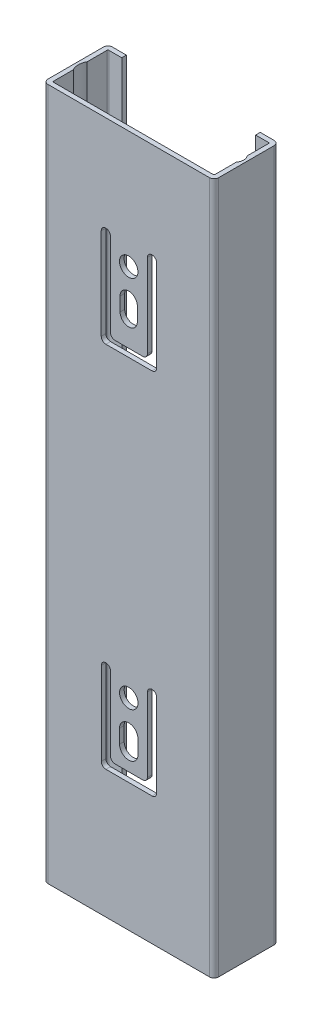
from build123d import *

# Parameters (mm, degrees)
BOSS_EXTRUDE1_DEPTH = 150
FILLET1_R           = 1
FILLET2_R           = 0.2
SKETCH2_R           = 2
CUT_EXTRUDE1_DEPTH  = 155.280557534
CUT_EXTRUDE2_DEPTH  = 155.280557534
CUT_EXTRUDE3_DEPTH  = 150
FILLET7_R           = 1
SKETCH7_R           = 2
CUT_EXTRUDE4_DEPTH  = 155.280557534
CUT_EXTRUDE6_DEPTH  = 155.280557534
FILLET9_R           = 1
SKETCH12_R          = 2
SKETCH12_R_2        = 3
CUT_EXTRUDE7_DEPTH  = 155.520226026


with BuildPart() as part:
    # Sketch1 → Boss-Extrude1 (new body)
    with BuildSketch(Plane(origin=(0, 0, 0), x_dir=(1, 0, 0), z_dir=(0, 1, 0))):
        Polygon((-2.736049046, -15.431975477), (32.263950954, -15.431975477), (32.263950954, -3.431975477), (29.263950954, -3.431975477), (29.263950954, -2.431975477), (33.263950954, -2.431975477), (33.263950954, -16.431975477), (-3.736049046, -16.431975477), (-3.736049046, -2.431975477), (0.263950954, -2.431975477), (0.263950954, -3.431975477), (-2.736049046, -3.431975477), align=None)
    extrude(amount=BOSS_EXTRUDE1_DEPTH)

    # Fillet1
    fillet1_edges = [part.edges().sort_by_distance(p)[0] for p in [
        (33.263950954, 75, 2.431975477),
        (33.263950954, 75, 16.431975477),
        (-3.736049046, 75, 16.431975477),
        (-3.736049046, 75, 2.431975477),
    ]]
    fillet(fillet1_edges, radius=FILLET1_R)

    # Fillet2
    fillet2_edges = [part.edges().sort_by_distance(p)[0] for p in [
        (-2.736049046, 75, 15.431975477),
        (32.263950954, 75, 15.431975477),
        (32.263950954, 75, 3.431975477),
        (-2.736049046, 75, 3.431975477),
    ]]
    fillet(fillet2_edges, radius=FILLET2_R)

    # Sketch2 → Cut-Extrude1 (cut, through all)
    with BuildSketch(Plane.XY.offset(16.431975477)):
        with Locations((14.763950954, 124.553168405)):
            Circle(SKETCH2_R)
    extrude(amount=-CUT_EXTRUDE1_DEPTH, mode=Mode.SUBTRACT)

    # Sketch4 → Cut-Extrude2 (cut, through all)
    with BuildSketch(Plane.XY.offset(16.431975477)):
        with BuildLine():
            Line((16.632444953, 118.100326697), (16.632444953, 115.100326697))
            ThreePointArc((16.632444953, 115.100326697), (14.763950954, 113.231832698), (12.895456955, 115.100326697))
            Line((12.895456955, 115.100326697), (12.895456955, 118.100326697))
            ThreePointArc((12.895456955, 118.100326697), (14.763950954, 119.968820696), (16.632444953, 118.100326697))
        make_face()
    extrude(amount=-CUT_EXTRUDE2_DEPTH, mode=Mode.SUBTRACT)

    # Sketch6 → Cut-Extrude3 (cut)
    with BuildSketch(Plane.XY.offset(16.431975477)):
        Polygon((18.810239274, 129.292771491), (18.810239274, 109.228960099), (10.810239274, 109.228960099), (10.810239274, 129.292771491), (8.810239274, 129.292771491), (8.810239274, 107.509210665), (20.810239274, 107.509210665), (20.810239274, 129.292771491), align=None)
    extrude(amount=-CUT_EXTRUDE3_DEPTH, mode=Mode.SUBTRACT)

    # Fillet7
    fillet7_edges = [part.edges().sort_by_distance(p)[0] for p in [
        (8.810239274, 107.509210665, 15.931975477),
        (20.810239274, 107.509210665, 15.931975477),
        (18.810239274, 109.228960099, 15.931975477),
        (10.810239274, 109.228960099, 15.931975477),
        (10.810239274, 129.292771491, 15.931975477),
        (8.810239274, 129.292771491, 15.931975477),
        (18.810239274, 129.292771491, 15.931975477),
        (20.810239274, 129.292771491, 15.931975477),
    ]]
    fillet(fillet7_edges, radius=FILLET7_R - 0.0001)  # a hair under: the kernel refuses the full size

    # Sketch7 → Cut-Extrude4 (cut, through all)
    with BuildSketch(Plane.XY.offset(16.431975477)):
        with Locations((14.782730099, 43.616424241)):
            Circle(SKETCH7_R)
        with BuildLine():
            Line((16.779852756, 36.933079114), (16.778561099, 33.933079392))
            ThreePointArc((16.778561099, 33.933079392), (14.77770018, 31.933940682), (12.77856147, 33.9348016))
            Line((12.77856147, 33.9348016), (12.779853126, 36.934801322))
            ThreePointArc((12.779853126, 36.934801322), (14.780714045, 38.933940033), (16.779852756, 36.933079114))
        make_face()
    extrude(amount=-CUT_EXTRUDE4_DEPTH, mode=Mode.SUBTRACT)

    # Sketch9 → Cut-Extrude6 (cut, through all)
    with BuildSketch(Plane.XY.offset(16.431975477)):
        Polygon((18.824358564, 47.739325349), (18.824358564, 29.739325349), (10.824358564, 29.739325349), (10.824358564, 47.739325349), (8.824358564, 47.739325349), (8.824358564, 27.739325349), (20.824358564, 27.739325349), (20.824358564, 47.739325349), align=None)
    extrude(amount=-CUT_EXTRUDE6_DEPTH, mode=Mode.SUBTRACT)

    # Fillet9
    fillet9_edges = [part.edges().sort_by_distance(p)[0] for p in [
        (20.824358564, 27.739325349, 15.931975477),
        (18.824358564, 29.739325349, 15.931975477),
        (8.824358564, 27.739325349, 15.931975477),
        (10.824358564, 29.739325349, 15.931975477),
        (8.824358564, 47.739325349, 15.931975477),
        (10.824358564, 47.739325349, 15.931975477),
        (18.824358564, 47.739325349, 15.931975477),
        (20.824358564, 47.739325349, 15.931975477),
    ]]
    fillet(fillet9_edges, radius=FILLET9_R - 0.0001)  # a hair under: the kernel refuses the full size

    # Sketch12 → Cut-Extrude7 (cut, through all)
    with BuildSketch(Plane(origin=(0, 150, 0), x_dir=(1, 0, 0), z_dir=(0, 1, 0))):
        with Locations((30.665950954, -9.431975477)):
            Circle(SKETCH12_R)
        with Locations((-0.138049046, -9.431975477)):
            Circle(SKETCH12_R_2)
    extrude(amount=-CUT_EXTRUDE7_DEPTH, mode=Mode.SUBTRACT)


solid = part.part
